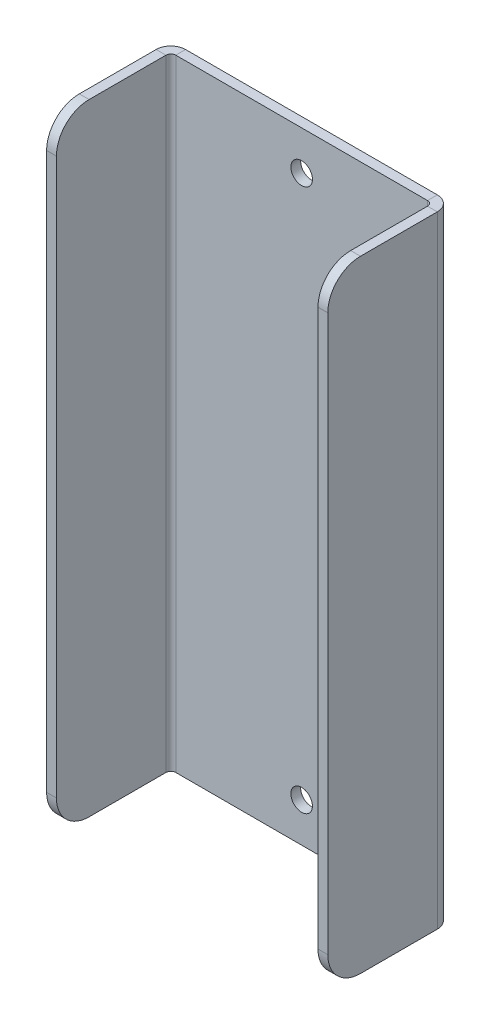
from build123d import *

# Parameters (mm, degrees)
CROQUIS1_W                         = 80
CROQUIS1_H                         = 190
BRIDA_BASE1_DEPTH                  = 3
BRIDA_DE_ARISTA1_STRIP_W           = 15
BRIDA_DE_ARISTA1_STRIP_H           = 3
BRIDA_DE_ARISTA1_STRIP_CUT_DEPTH   = 190
BRIDA_DE_ARISTA1_STRIP_2_W         = 15
BRIDA_DE_ARISTA1_STRIP_2_H         = 3
BRIDA_DE_ARISTA1_STRIP_CUT_2_DEPTH = 190
BRIDA_DE_ARISTA1_DEPTH             = 190
BRIDA_DE_ARISTA1_BEND_DEPTH        = 190
TALADRO_DE_MARGEN_PARA_M61_D       = 6.6
TALADRO_DE_MARGEN_PARA_M61_DEPTH   = 500
TALADRO_DE_MARGEN_PARA_M61_TIP     = 1.982840043
REDONDEO2_R                        = 10


# Sheet-metal steps are written as plain solids
with BuildPart() as part:
    # Croquis1 → Brida base1 (new body)
    with BuildSketch(Plane.XY):
        Rectangle(CROQUIS1_W, CROQUIS1_H)
    extrude(amount=-BRIDA_BASE1_DEPTH)

    # Brida de arista1 strip (across the edge) → Brida de arista1 strip cut (cut)
    with BuildSketch(Plane(origin=(-40, 95, 0), x_dir=(1, 0, 0), z_dir=(0, -1, 0))):
        with Locations((-6, -1.5)):
            Rectangle(BRIDA_DE_ARISTA1_STRIP_W, BRIDA_DE_ARISTA1_STRIP_H)
    extrude(amount=BRIDA_DE_ARISTA1_STRIP_CUT_DEPTH, mode=Mode.SUBTRACT)

    # Brida de arista1 strip 2 (across the edge) → Brida de arista1 strip cut 2 (cut)
    with BuildSketch(Plane(origin=(40, -95, 0), x_dir=(-1, 0, 0), z_dir=(0, 1, 0))):
        with Locations((-6, -1.5)):
            Rectangle(BRIDA_DE_ARISTA1_STRIP_2_W, BRIDA_DE_ARISTA1_STRIP_2_H)
    extrude(amount=BRIDA_DE_ARISTA1_STRIP_CUT_2_DEPTH, mode=Mode.SUBTRACT)

    # Brida de arista1 section (across the edge) → Brida de arista1 (add)
    with BuildSketch(Plane(origin=(-40, 95, 0), x_dir=(1, 0, 0), z_dir=(0, -1, 0))):
        with BuildLine():
            Line((-3, 1.5), (-3, 35))
            Line((-3, 35), (0, 35))
            Line((0, 35), (0, 1.5))
            ThreePointArc((0, 1.5), (0.439339828, 0.439339828), (1.5, 0))
            Line((1.5, 0), (1.5, -3))
            ThreePointArc((1.5, -3), (-1.681980515, -1.681980515), (-3, 1.5))
        make_face()
    extrude(amount=BRIDA_DE_ARISTA1_DEPTH)

    # Brida de arista1 section 2 (across the edge) → Brida de arista1 bend (add)
    with BuildSketch(Plane(origin=(40, -95, 0), x_dir=(-1, 0, 0), z_dir=(0, 1, 0))):
        with BuildLine():
            Line((-3, 1.5), (-3, 35))
            Line((-3, 35), (0, 35))
            Line((0, 35), (0, 1.5))
            ThreePointArc((0, 1.5), (0.439339828, 0.439339828), (1.5, 0))
            Line((1.5, 0), (1.5, -3))
            ThreePointArc((1.5, -3), (-1.681980515, -1.681980515), (-3, 1.5))
        make_face()
    extrude(amount=BRIDA_DE_ARISTA1_BEND_DEPTH)

    # Taladro de margen para M61
    with Locations(Plane.XY):
        with Locations((0, 83), (0, -83)):
            Hole(TALADRO_DE_MARGEN_PARA_M61_D / 2, depth=TALADRO_DE_MARGEN_PARA_M61_DEPTH)
            with Locations((0, 0, -(TALADRO_DE_MARGEN_PARA_M61_DEPTH + TALADRO_DE_MARGEN_PARA_M61_TIP / 2))):  # 118° drill point
                Cone(0, TALADRO_DE_MARGEN_PARA_M61_D / 2, TALADRO_DE_MARGEN_PARA_M61_TIP, mode=Mode.SUBTRACT)

    # Redondeo2
    redondeo2_edges = [part.edges().sort_by_distance(p)[0] for p in [
        (-41.5, 95, 35),
        (-41.5, -95, 35),
        (41.5, -95, 35),
        (41.5, 95, 35),
    ]]
    fillet(redondeo2_edges, radius=REDONDEO2_R)


solid = part.part
